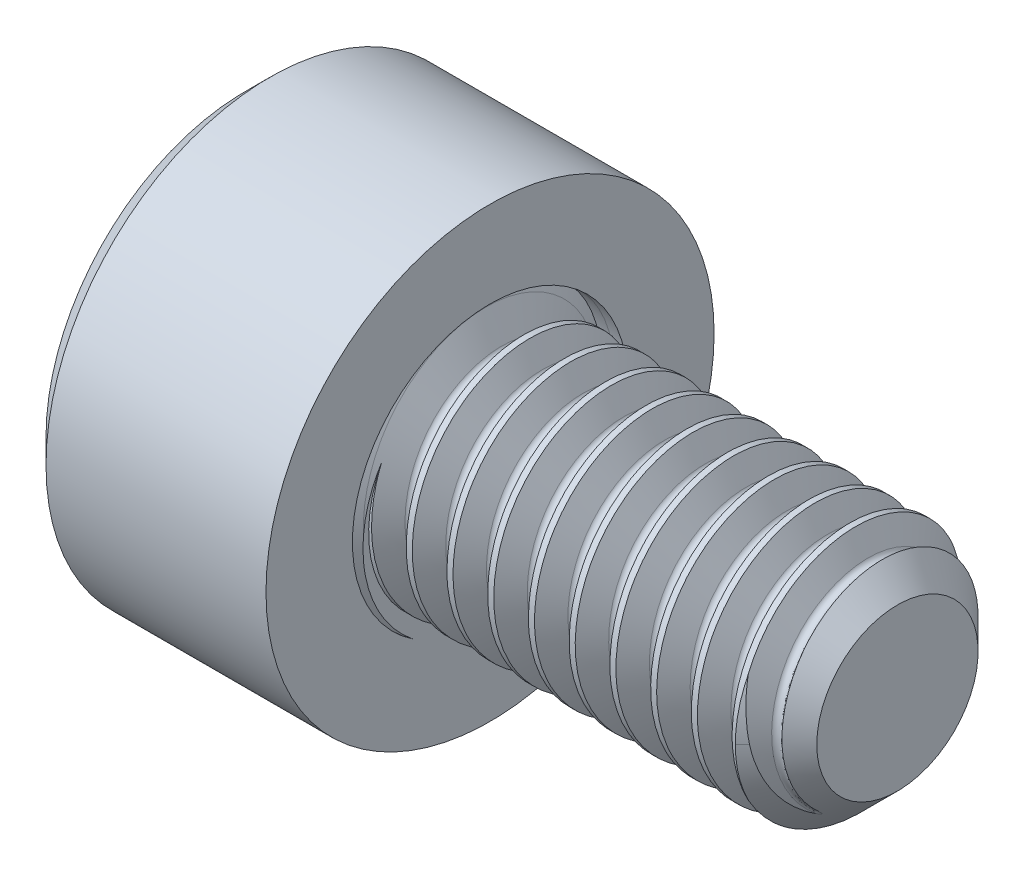
from build123d import *

# Parameters (mm, degrees)
CHAMFER1_SIZE      = 0.5
CHAMFER2_SIZE      = 0.3
CUT_EXTRUDE1_DEPTH = 2.5
CHAMFER3_SIZE      = 0.3
CUT_SWEEP1_PITCH   = 0.5
CUT_SWEEP1_HEIGHT  = 5
CUT_SWEEP1_RADIUS  = 1.5


with BuildPart() as part:
    # Sketch1 → Revolve1 (revolve)
    with BuildSketch(Plane.XY):
        Polygon((0, 0), (0, 2.75), (3, 2.75), (3, 1.49), (8, 1.49), (8, 0), align=None)
    revolve(axis=Axis((-88.705490849, 0, 0), (1, 0, 0)))

    # Chamfer1
    chamfer1_edges = [part.edges().sort_by_distance(p)[0] for p in [
        (8, -1.49, 0),
    ]]
    chamfer(chamfer1_edges, length=CHAMFER1_SIZE)

    # Chamfer2
    chamfer2_edges = [part.edges().sort_by_distance(p)[0] for p in [
        (0, -2.75, 0),
    ]]
    chamfer(chamfer2_edges, length=CHAMFER2_SIZE)

    # Sketch3 → Cut-Extrude1 (cut)
    with BuildSketch(Plane(origin=(0, 0, 0), x_dir=(0, 0, -1), z_dir=(1, 0, 0))):
        Polygon((-1.443375673, 0), (-0.721687836, -1.25), (0.721687836, -1.25), (1.443375673, 0), (0.721687836, 1.25), (-0.721687836, 1.25), align=None)
    extrude(amount=CUT_EXTRUDE1_DEPTH, mode=Mode.SUBTRACT)

    # Chamfer3
    chamfer3_edges = [part.edges().sort_by_distance(p)[0] for p in [
        (0, 1.25, 0),
        (0, 0.625, 1.082531755),
        (0, -0.625, 1.082531755),
        (0, -1.25, 0),
        (0, -0.625, -1.082531755),
        (0, 0.625, -1.082531755),
    ]]
    chamfer(chamfer3_edges, length=CHAMFER3_SIZE)

    # Cut-Sweep1: sweep along a helix
    with BuildLine() as cut_sweep1_path:
        Helix(CUT_SWEEP1_PITCH, CUT_SWEEP1_HEIGHT, CUT_SWEEP1_RADIUS, center=(8, 0, 0), direction=(-1, 0, 0))
    # Sketch8 → Cut-Sweep1 (sweep, cut)
    with BuildSketch(Plane(origin=(0, 0, 0), x_dir=(1, 0, 0), z_dir=(0, 1, 0))):
        with BuildLine():
            Line((8.062498167, 1.229375), (8.328115375, 1.6894375))
            Line((8.328115375, 1.6894375), (7.671884625, 1.6894375))
            Line((7.671884625, 1.6894375), (7.937501833, 1.229375))
            ThreePointArc((7.937501833, 1.229375), (8, 1.193291667), (8.062498167, 1.229375))
        make_face()
    sweep(path=cut_sweep1_path.line, is_frenet=True, mode=Mode.SUBTRACT)


solid = part.part
